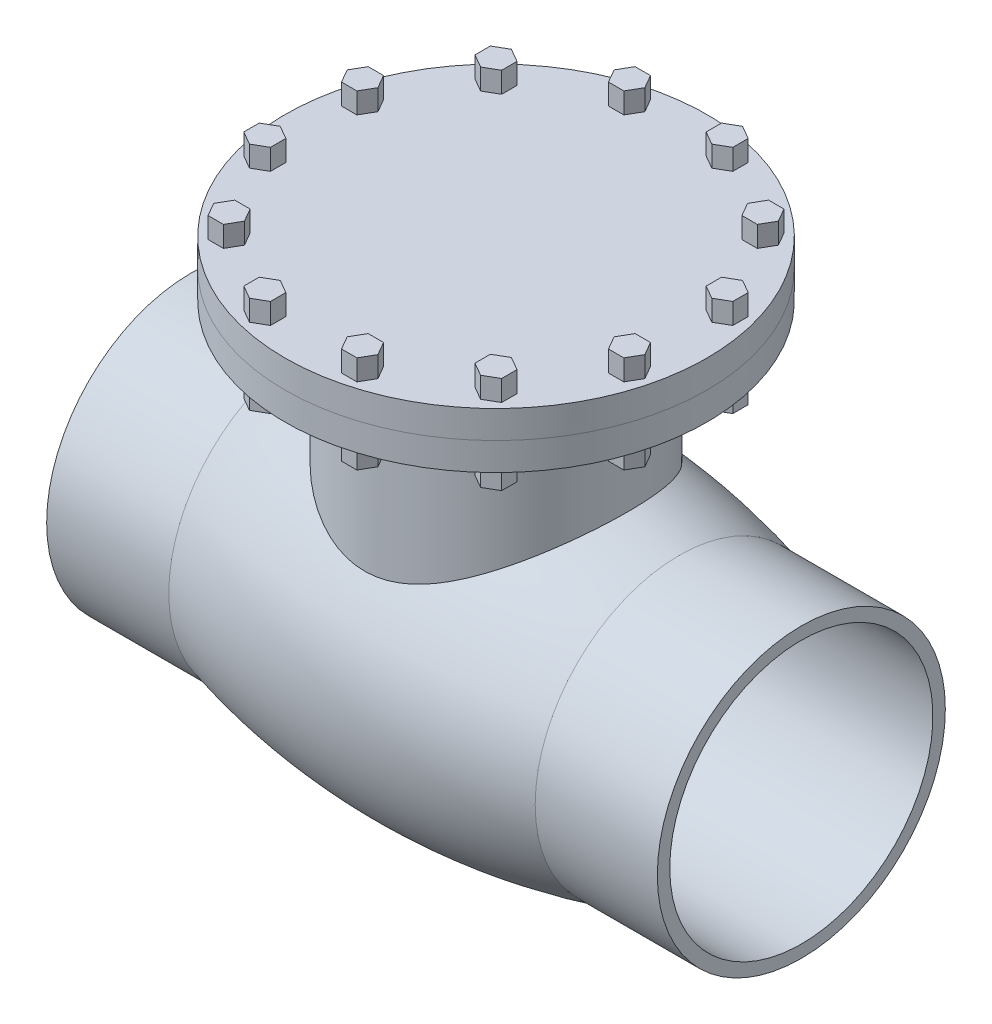
from build123d import *

# Parameters (mm, degrees)
BODY_EXTRUDE_SKETCH_R  = 150.4
BODY_EXTRUDE_DEPTH     = 376
FLANGE_BOTTOM_SKETCH_R = 241.3
FLANGE_BOTTOM_DEPTH    = 31.75
FLANGE_TOP_SKETCH_R    = 241.3
FLANGE_TOP_DEPTH       = 31.75
ID_SKETCH_R            = 150.495
ID_CUT_DEPTH           = 830.158573495
BOLT_DEPTH             = 111.125
BOLT_PATTERN_COUNT     = 12
BOLT_PATTERN_ANGLE     = 330


with BuildPart() as part:
    # Flow Extrude Sketch → Flow Extrude (revolve)
    with BuildSketch(Plane.XY):
        with BuildLine():
            Line((209.55, 164.719), (349.25, 164.719))
            Line((349.25, 164.719), (349.25, 0))
            Line((349.25, 0), (-349.25, 0))
            Line((-349.25, 0), (-349.25, 164.719))
            Line((-349.25, 164.719), (-209.55, 164.719))
            ThreePointArc((-209.55, 164.719), (0, 192.0875), (209.55, 164.719))
        make_face()
    revolve(axis=Axis((-245.321131649, 0, 0), (1, 0, 0)))

    # Body Extrude Sketch → Body Extrude (add)
    with BuildSketch(Plane(origin=(0, 0, 0), x_dir=(1, 0, 0), z_dir=(0, 1, 0))):
        Circle(BODY_EXTRUDE_SKETCH_R)
    extrude(amount=BODY_EXTRUDE_DEPTH)

    # Flange Bottom Sketch → Flange Bottom (add)
    with BuildSketch(Plane(origin=(0, 376, 0), x_dir=(-1, 0, 0), z_dir=(0, 1, 0))):
        Circle(FLANGE_BOTTOM_SKETCH_R)
    extrude(amount=-FLANGE_BOTTOM_DEPTH)

    # Flange Top Sketch → Flange Top (add)
    with BuildSketch(Plane.XZ.offset(-344.25)):
        Circle(FLANGE_TOP_SKETCH_R)
    extrude(amount=FLANGE_TOP_DEPTH)

    # ID Sketch → ID Cut (cut, through all)
    with BuildSketch(Plane.ZY.offset(-349.25)):
        Circle(ID_SKETCH_R)
    extrude(amount=ID_CUT_DEPTH, mode=Mode.SUBTRACT)

    # Bolt Sketch → Bolt (add)
    with BuildSketch(Plane(origin=(0, 399.8125, 0), x_dir=(-1, 0, 0), z_dir=(0, 1, 0))):
        Polygon((-208.543385896, -38.281395633), (-223.783385896, -47.080213735), (-223.783385896, -64.67784994), (-208.543385896, -73.476668043), (-193.303385896, -64.67784994), (-193.303385896, -47.080213735), align=None)
    bolt = extrude(amount=-BOLT_DEPTH)

    # Bolt Pattern: Bolt ×12 about axis
    bolt_pattern_axis = Axis((0, 344.25, 0), (0, 1, 0))
    for i in range(1, BOLT_PATTERN_COUNT):
        add(bolt.rotate(bolt_pattern_axis, i * BOLT_PATTERN_ANGLE / (BOLT_PATTERN_COUNT - 1)))


solid = part.part
